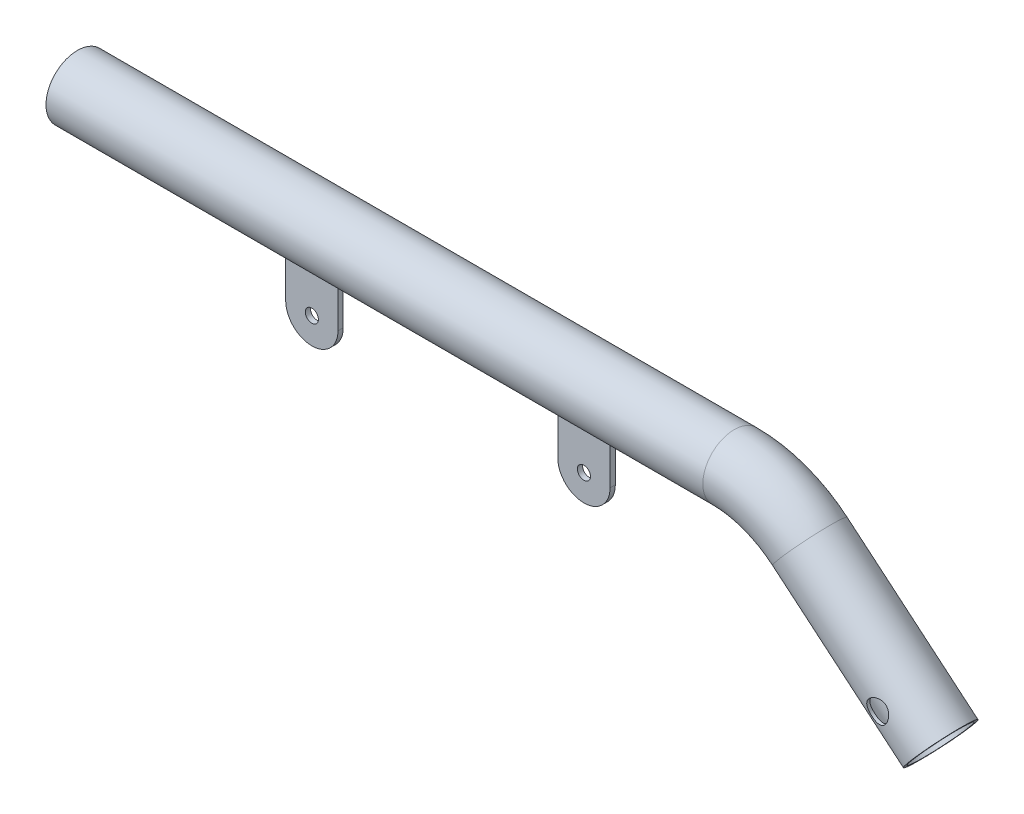
from build123d import *

# Parameters (mm, degrees)
SKETCH2_R                = 12
SKETCH2_R_2              = 10.8
CUT_EXTRUDE1_DEPTH       = 20
CUT_EXTRUDE1_DEPTH_BACK  = 20
SKETCH3_R                = 4.14257131
BOSS_EXTRUDE1_DEPTH      = 1
BOSS_EXTRUDE1_DEPTH_BACK = 1
SKETCH4_R                = 2.5
CUT_EXTRUDE2_START       = -240
SKETCH5_R                = 10.8
CUT_EXTRUDE2_DEPTH       = 240


with BuildPart() as part:
    # Sweep1: sweep along a path in Sketch1
    with BuildLine(Plane.XY) as sweep1_path:
        Line((-209.367896725, 0), (41.706660839, 0))
        ThreePointArc((41.706660839, 0), (57.097567289, -2.713832065), (70.632103275, -10.52800006))
        Line((70.632103275, -10.52800006), (120.632103275, -52.482981619))
    # Sketch2 → Sweep1 (sweep)
    with BuildSketch(Plane(origin=(-209.367896725, 0, 0), x_dir=(0, 0, -1), z_dir=(1, 0, 0))):
        Circle(SKETCH2_R)
        Circle(SKETCH2_R_2, mode=Mode.SUBTRACT)
    sweep(path=sweep1_path.line)

    # Sketch3 → Cut-Extrude1 (cut, two sides: drawn at the far end of the back side and taken through both)
    with BuildSketch(Plane.XY.offset(-CUT_EXTRUDE1_DEPTH_BACK)):
        with Locations((108.258660408, -42.100430272)):
            Circle(SKETCH3_R)
    extrude(amount=CUT_EXTRUDE1_DEPTH + CUT_EXTRUDE1_DEPTH_BACK, mode=Mode.SUBTRACT)

    # Sketch4 → Boss-Extrude1 (add, two sides: drawn at the far end of the back side and taken through both)
    # profile 1 of 2: a face of its own
    with BuildSketch(Plane.XY.offset(-BOSS_EXTRUDE1_DEPTH_BACK)):
        with BuildLine():
            Line((-128.741339592, 0), (-128.741339592, -30))
            ThreePointArc((-128.741339592, -30), (-118.741339592, -40), (-108.741339592, -30))
            Line((-108.741339592, -30), (-108.741339592, 0))
            Line((-108.741339592, 0), (-128.741339592, 0))
        make_face()
        with Locations((-118.741339592, -30)):
            Circle(SKETCH4_R, mode=Mode.SUBTRACT)
    # profile 2 of 2: a face of its own
    with BuildSketch(Plane.XY.offset(-BOSS_EXTRUDE1_DEPTH_BACK)):
        with BuildLine():
            Line((-24.741339592, 0), (-4.741339592, 0))
            Line((-4.741339592, 0), (-4.741339592, -30))
            ThreePointArc((-4.741339592, -30), (-14.741339592, -40), (-24.741339592, -30))
            Line((-24.741339592, -30), (-24.741339592, 0))
        make_face()
        with Locations((-14.741339592, -30)):
            Circle(SKETCH4_R, mode=Mode.SUBTRACT)
    extrude(amount=BOSS_EXTRUDE1_DEPTH + BOSS_EXTRUDE1_DEPTH_BACK)

    # Sketch5 → Cut-Extrude2 (cut)
    with BuildSketch(Plane.ZY.offset(209.367896725).offset(CUT_EXTRUDE2_START)):
        Circle(SKETCH5_R)
    extrude(amount=CUT_EXTRUDE2_DEPTH, mode=Mode.SUBTRACT)


solid = part.part
